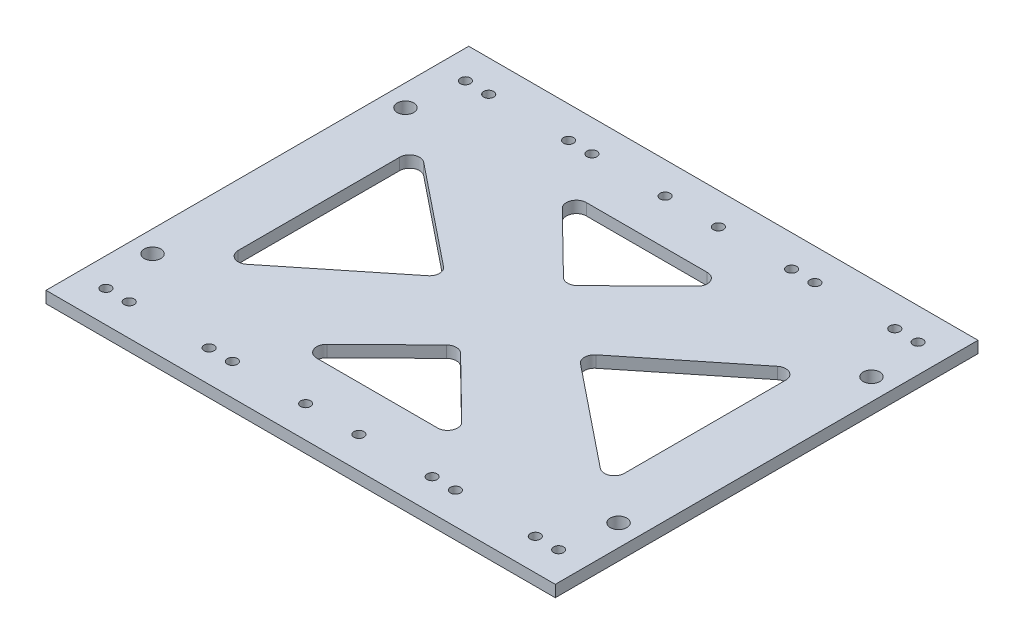
from build123d import *

# Parameters (mm, degrees)
SKETCH1_R            = 2.5
SKETCH1_R_2          = 1.5
BOSS_EXTRUDE1_DEPTH  = 3.5
MIRROR26_OUTLINE_R   = 1.5
MIRROR26_OUTLINE_R_2 = 2.5
MIRROR26_DEPTH       = 3.5
FILLET1_R            = 3
FILLET4_R            = 3
FILLET5_R            = 3
FILLET6_R            = 3


# Read off the part's stored shape, not the designer's step: Mirror26
with BuildPart() as part:
    # Sketch1 → Boss-Extrude1 (new body)
    with BuildSketch(Plane(origin=(0, 0, 0), x_dir=(1, 0, 0), z_dir=(0, 1, 0))):
        Polygon((0, -63.5), (18.5, -63.5), (18.5, -33), (56.5, -63.5), (76.5, -63.5), (76.5, -48), (51, -23), (76.5, -23), (76.5, 0), (0, 0), align=None)
        with Locations(Location((6.5, -25.5, 0), (0, 0, 270))):
            Circle(SKETCH1_R, mode=Mode.SUBTRACT)
        with Locations(Location((8.5, -9.5, 0), (0, 0, 270))):
            Circle(SKETCH1_R_2, mode=Mode.SUBTRACT)
        with Locations(Location((15.5, -9.5, 0), (0, 0, 270))):
            Circle(SKETCH1_R_2, mode=Mode.SUBTRACT)
        with Locations(Location((39.5, -9.5, 0), (0, 0, 270))):
            Circle(SKETCH1_R_2, mode=Mode.SUBTRACT)
        with Locations(Location((46.5, -9.5, 0), (0, 0, 270))):
            Circle(SKETCH1_R_2, mode=Mode.SUBTRACT)
        with Locations(Location((68.5, -9.5, 0), (0, 0, 270))):
            Circle(SKETCH1_R_2, mode=Mode.SUBTRACT)
    boss_extrude1 = extrude(amount=BOSS_EXTRUDE1_DEPTH)

    # Mirror1: Boss-Extrude1 across plane
    add(boss_extrude1.mirror(Plane(origin=(0, 3.5, 63.5), x_dir=(1, 0, 0), z_dir=(0, 0, -1))))

    # Mirror26 outline → Mirror26 (add)
    with BuildSketch(Plane(origin=(0, 0, 0), x_dir=(1, 0, 0), z_dir=(0, 1, 0))):
        Polygon((76.5, -23), (102, -23), (76.5, -48), (76.5, -63.5), (96.5, -63.5), (134.5, -33), (134.5, -63.5), (153, -63.5), (153, 0), (76.5, 0), align=None)
        with Locations((84.5, -9.5)):
            Circle(MIRROR26_OUTLINE_R, mode=Mode.SUBTRACT)
        with Locations((106.5, -9.5)):
            Circle(MIRROR26_OUTLINE_R, mode=Mode.SUBTRACT)
        with Locations((113.5, -9.5)):
            Circle(MIRROR26_OUTLINE_R, mode=Mode.SUBTRACT)
        with Locations((146.5, -25.5)):
            Circle(MIRROR26_OUTLINE_R_2, mode=Mode.SUBTRACT)
        with Locations((137.5, -9.5)):
            Circle(MIRROR26_OUTLINE_R, mode=Mode.SUBTRACT)
        with Locations((144.5, -9.5)):
            Circle(MIRROR26_OUTLINE_R, mode=Mode.SUBTRACT)
    mirror26 = extrude(amount=MIRROR26_DEPTH)

    # Mirror27: Mirror26 across plane
    add(mirror26.mirror(Plane(origin=(153, 3.5, 63.5), x_dir=(1, 0, 0), z_dir=(0, 0, 1))))

    # Fillet1
    fillet1_edges = [part.edges().sort_by_distance(p)[0] for p in [
        (56.5, 1.75, 63.5),
        (18.5, 1.75, 33),
        (18.5, 1.75, 94),
    ]]
    fillet(fillet1_edges, radius=FILLET1_R)

    # Fillet4
    fillet4_edges = [part.edges().sort_by_distance(p)[0] for p in [
        (76.5, 1.75, 48),
        (51, 1.75, 23),
        (102, 1.75, 23),
    ]]
    fillet(fillet4_edges, radius=FILLET4_R)

    # Fillet5
    fillet5_edges = [part.edges().sort_by_distance(p)[0] for p in [
        (134.5, 1.75, 94),
        (96.5, 1.75, 63.5),
        (134.5, 1.75, 33),
    ]]
    fillet(fillet5_edges, radius=FILLET5_R)

    # Fillet6
    fillet6_edges = [part.edges().sort_by_distance(p)[0] for p in [
        (102, 1.75, 104),
        (51, 1.75, 104),
        (76.5, 1.75, 79),
    ]]
    fillet(fillet6_edges, radius=FILLET6_R)


solid = part.part
